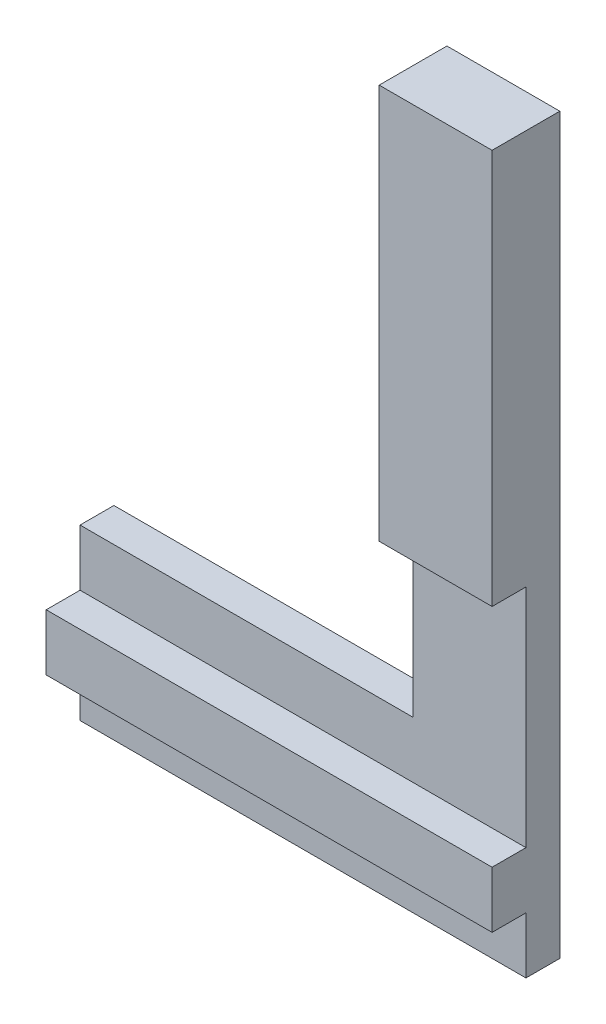
from build123d import *

# Parameters (mm, degrees)
SKETCH1_W           = 20
SKETCH1_H           = 100
BOSS_EXTRUDE4_DEPTH = 6
BOSS_EXTRUDE5_DEPTH = 6
SKETCH3_W           = 79
SKETCH3_H           = 10
BOSS_EXTRUDE6_DEPTH = 6
SKETCH6_W           = 20
SKETCH6_H           = 70
BOSS_EXTRUDE8_DEPTH = 6


with BuildPart() as part:
    # Sketch1 → Boss-Extrude4 (new body)
    with BuildSketch(Plane.XY):
        with Locations((69, 50)):
            Rectangle(SKETCH1_W, SKETCH1_H)
    extrude(amount=BOSS_EXTRUDE4_DEPTH)

    # Sketch1<8> → Boss-Extrude5 (add)
    with BuildSketch(Plane.XY):
        Polygon((79, -30), (79, 0), (59, 0), (20, 0), (0, 0), (0, -30), align=None)
    extrude(amount=BOSS_EXTRUDE5_DEPTH)

    # Sketch3 → Boss-Extrude6 (add)
    with BuildSketch(Plane.XY.offset(6)):
        with Locations((39.5, -15)):
            Rectangle(SKETCH3_W, SKETCH3_H)
    extrude(amount=BOSS_EXTRUDE6_DEPTH)

    # Sketch6 → Boss-Extrude8 (add)
    with BuildSketch(Plane.XY.offset(6)):
        with Locations((69, 65)):
            Rectangle(SKETCH6_W, SKETCH6_H)
    extrude(amount=BOSS_EXTRUDE8_DEPTH)


solid = part.part
